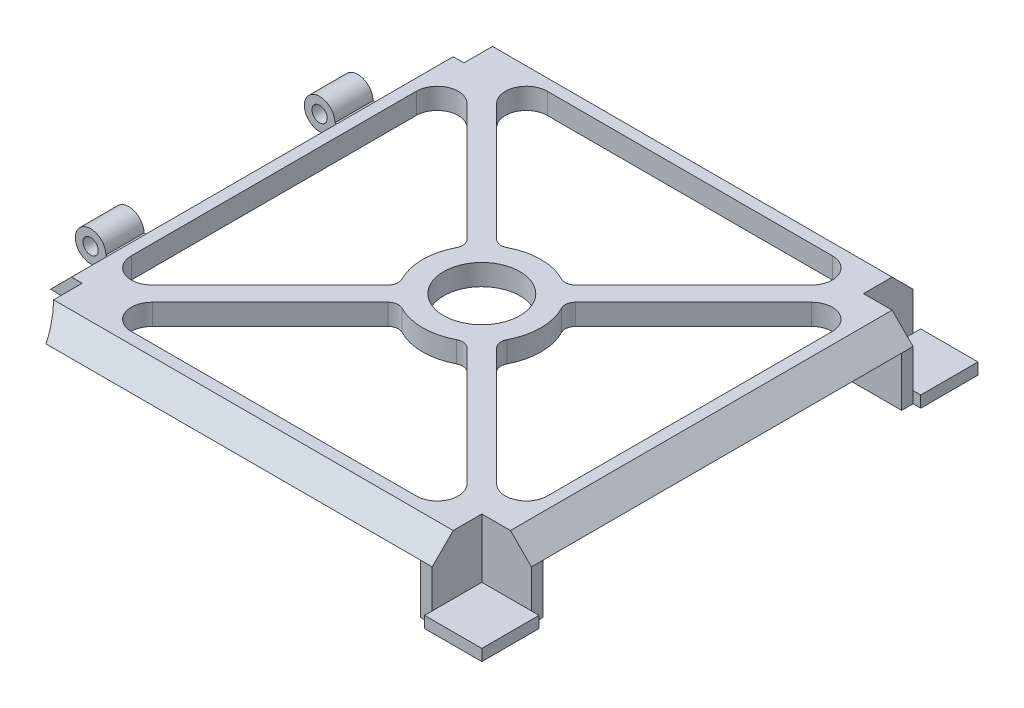
from build123d import *

# Parameters (mm, degrees)
SKETCH1_W              = 126
SKETCH1_H              = 126
BOSS_EXTRUDE1_DEPTH    = 5.5
CUT_EXTRUDE5_DEPTH     = 179.275769526
SKETCH8_R              = 10
CUT_EXTRUDE6_DEPTH     = 179.275769526
FILLET1_R              = 5.5
FILLET2_R              = 2.75
SKETCH11_W             = 13
SKETCH11_H             = 13
CUT_EXTRUDE7_DEPTH     = 179.275769526
BOSS_EXTRUDE8_START    = -15
SKETCH18_R             = 2
BOSS_EXTRUDE8_DEPTH    = 10
BOSS_EXTRUDE9_START    = -75
SKETCH18_2_R           = 2
BOSS_EXTRUDE9_DEPTH    = 10
BOSS_EXTRUDE10_DEPTH   = 10
BOSS_EXTRUDE11_DEPTH   = 3
BOSS_EXTRUDE12_DEPTH   = 4.692640137
BOSS_EXTRUDE12_START   = -13
BOSS_EXTRUDE12_2_DEPTH = 14
BOSS_EXTRUDE13_DEPTH   = 4.692640137
BOSS_EXTRUDE13_START   = -127
BOSS_EXTRUDE13_2_DEPTH = 14
CHAMFER1_SIZE          = 2


with BuildPart() as part:
    # Sketch1 → Boss-Extrude1 (new body)
    with BuildSketch(Plane(origin=(0, 0, 0), x_dir=(1, 0, 0), z_dir=(0, 1, 0))):
        with Locations((63, 63)):
            Rectangle(SKETCH1_W, SKETCH1_H)
    extrude(amount=BOSS_EXTRUDE1_DEPTH)

    # Sketch7 → Cut-Extrude5 (cut, through all)
    with BuildSketch(Plane.XY):
        Polygon((0, 0), (0, 5.5), (5.5, 5.5), align=None)
        Polygon((126, 0), (126, 5.5), (120.5, 5.5), align=None)
    cut_extrude5 = extrude(amount=-CUT_EXTRUDE5_DEPTH, mode=Mode.SUBTRACT)

    # Mirror1: Cut-Extrude5 across plane
    add(cut_extrude5.mirror(Plane(origin=(0, 0, 0), x_dir=(-0.7071067811865476, 0, 0.7071067811865476), z_dir=(-0.7071067811865477, 0, -0.7071067811865475))), mode=Mode.SUBTRACT)

    # Sketch8 → Cut-Extrude6 (cut, through all)
    with BuildSketch(Plane(origin=(0, 5.5, 0), x_dir=(1, 0, 0), z_dir=(0, 1, 0))):
        with Locations(Location((63, 63, 0), (0, 0, 270))):
            Circle(SKETCH8_R)
        with BuildLine():
            Line((50.269180349, 54.158267646), (8.5, 12.389087297))
            Line((8.5, 12.389087297), (8.5, 113.610912703))
            Line((8.5, 113.610912703), (50.269180349, 71.841732354))
            ThreePointArc((50.269180349, 71.841732354), (47.5, 63), (50.269180349, 54.158267646))
        make_face()
        with BuildLine():
            Line((54.158267646, 75.730819651), (12.389087297, 117.5))
            Line((12.389087297, 117.5), (113.610912703, 117.5))
            Line((113.610912703, 117.5), (71.841732354, 75.730819651))
            ThreePointArc((71.841732354, 75.730819651), (63, 78.5), (54.158267646, 75.730819651))
        make_face()
        with BuildLine():
            Line((75.730819651, 71.841732354), (117.5, 113.610912703))
            Line((117.5, 113.610912703), (117.5, 12.389087297))
            Line((117.5, 12.389087297), (75.730819651, 54.158267646))
            ThreePointArc((75.730819651, 54.158267646), (78.5, 63), (75.730819651, 71.841732354))
        make_face()
        with BuildLine():
            Line((71.841732354, 50.269180349), (113.610912703, 8.5))
            Line((113.610912703, 8.5), (12.389087297, 8.5))
            Line((12.389087297, 8.5), (54.158267646, 50.269180349))
            ThreePointArc((54.158267646, 50.269180349), (63, 47.5), (71.841732354, 50.269180349))
        make_face()
    extrude(amount=-CUT_EXTRUDE6_DEPTH, mode=Mode.SUBTRACT)

    # Fillet1
    fillet1_edges = [part.edges().sort_by_distance(p)[0] for p in [
        (113.610912703, 2.75, -8.5),
        (12.389087297, 2.75, -8.5),
        (117.5, 2.75, -113.610912703),
        (117.5, 2.75, -12.389087297),
        (12.389087297, 2.75, -117.5),
        (113.610912703, 2.75, -117.5),
        (8.5, 2.75, -12.389087297),
        (8.5, 2.75, -113.610912703),
    ]]
    fillet(fillet1_edges, radius=FILLET1_R)

    # Fillet2
    fillet2_edges = [part.edges().sort_by_distance(p)[0] for p in [
        (54.158267646, 2.75, -50.269180349),
        (71.841732354, 2.75, -50.269180349),
        (75.730819651, 2.75, -54.158267646),
        (75.730819651, 2.75, -71.841732354),
        (71.841732354, 2.75, -75.730819651),
        (54.158267646, 2.75, -75.730819651),
        (50.269180349, 2.75, -71.841732354),
        (50.269180349, 2.75, -54.158267646),
    ]]
    fillet(fillet2_edges, radius=FILLET2_R)

    # Sketch11 → Cut-Extrude7 (cut, through all)
    with BuildSketch(Plane(origin=(0, 5.5, 0), x_dir=(1, 0, 0), z_dir=(0, 1, 0))):
        with Locations((6.5, 119.5)):
            Rectangle(SKETCH11_W, SKETCH11_H)
        with Locations((119.5, 119.5)):
            Rectangle(SKETCH11_W, SKETCH11_H)
        with Locations((119.5, 6.5)):
            Rectangle(SKETCH11_W, SKETCH11_H)
        with Locations((6.5, 6.5)):
            Rectangle(SKETCH11_W, SKETCH11_H)
    extrude(amount=-CUT_EXTRUDE7_DEPTH, mode=Mode.SUBTRACT)

    # Sketch18 → Boss-Extrude8 (add)
    with BuildSketch(Plane(origin=(0, 0, -113), x_dir=(-1, 0, 0), z_dir=(0, 0, -1)).offset(BOSS_EXTRUDE8_START)):
        with BuildLine():
            Line((-6.5, 0), (0.5, 0))
            ThreePointArc((0.5, 0), (8.363703305, 1.03527618), (1.035898385, -2))
            Line((1.035898385, -2), (-6.5, -2))
            Line((-6.5, -2), (-6.5, 0))
        make_face()
        with Locations((4.5, 0)):
            Circle(SKETCH18_R, mode=Mode.SUBTRACT)
    extrude(amount=-BOSS_EXTRUDE8_DEPTH)

    # Sketch18<2> → Boss-Extrude9 (add)
    with BuildSketch(Plane(origin=(0, 0, -113), x_dir=(-1, 0, 0), z_dir=(0, 0, -1)).offset(BOSS_EXTRUDE9_START)):
        with BuildLine():
            Line((-6.5, 0), (0.5, 0))
            ThreePointArc((0.5, 0), (8.363703305, 1.03527618), (1.035898385, -2))
            Line((1.035898385, -2), (-6.5, -2))
            Line((-6.5, -2), (-6.5, 0))
        make_face()
        with Locations((4.5, 0)):
            Circle(SKETCH18_2_R, mode=Mode.SUBTRACT)
    extrude(amount=-BOSS_EXTRUDE9_DEPTH)

    # Sketch19 → Boss-Extrude10 (add)
    with BuildSketch(Plane.XZ):
        Polygon((126, -113), (113, -113), (113, -126), (110, -126), (110, -110), (126, -110), align=None)
        Polygon((126, -16), (126, -13), (113, -13), (113, 0), (110, 0), (110, -16), align=None)
    extrude(amount=BOSS_EXTRUDE10_DEPTH)

    # Sketch20 → Boss-Extrude11 (add)
    with BuildSketch(Plane.XZ.offset(10)):
        Polygon((110, -16), (126, -16), (126, -13), (128, -13), (128, 2), (113, 2), (113, 0), (110, 0), align=None)
        Polygon((126, -110), (126, -113), (128, -113), (128, -128), (113, -128), (113, -126), (110, -126), (110, -110), align=None)
    extrude(amount=BOSS_EXTRUDE11_DEPTH)

    # Boss-Extrude12: read off the stored shape, not the designer's step
    # Boss-Extrude12 outline → Boss-Extrude12 (add)
    with BuildSketch(Plane.ZY.offset(-13)):
        Polygon((-13, 5.5), (-13, 0), (0, 0), (-5.5, 5.5), align=None)
    extrude(amount=BOSS_EXTRUDE12_DEPTH)

    # Boss-Extrude12 2 outline → Boss-Extrude12 2 (cut)
    with BuildSketch(Plane.XY.offset(BOSS_EXTRUDE12_START)):
        with BuildLine():
            Line((8.307359863, 0), (11.819098493, 0))
            ThreePointArc((11.819098493, 0), (10.365939115, 2.943279669), (8.307359863, 5.5))
            Line((8.307359863, 5.5), (8.307359863, 0))
        make_face()
    extrude(amount=BOSS_EXTRUDE12_2_DEPTH, mode=Mode.SUBTRACT)

    # Boss-Extrude13: read off the stored shape, not the designer's step
    # Boss-Extrude13 outline → Boss-Extrude13 (add)
    with BuildSketch(Plane.ZY.offset(-13)):
        Polygon((-120.5, 5.5), (-126, 0), (-113, 0), (-113, 5.5), align=None)
    extrude(amount=BOSS_EXTRUDE13_DEPTH)

    # Boss-Extrude13 2 outline → Boss-Extrude13 2 (cut)
    with BuildSketch(Plane.XY.offset(BOSS_EXTRUDE13_START)):
        with BuildLine():
            ThreePointArc((11.819098492, 0), (10.365939114, 2.943279669), (8.307359863, 5.5))
            Line((8.307359863, 5.5), (8.307359863, 0))
            Line((8.307359863, 0), (11.819098492, 0))
        make_face()
    extrude(amount=BOSS_EXTRUDE13_2_DEPTH, mode=Mode.SUBTRACT)

    # Chamfer1
    chamfer1_edges = [part.edges().sort_by_distance(p)[0] for p in [
        (6.5, 0, -93),
        (6.5, 0, -33),
    ]]
    chamfer(chamfer1_edges, length=CHAMFER1_SIZE - 0.0001)  # a hair under: the kernel refuses the full size


solid = part.part
